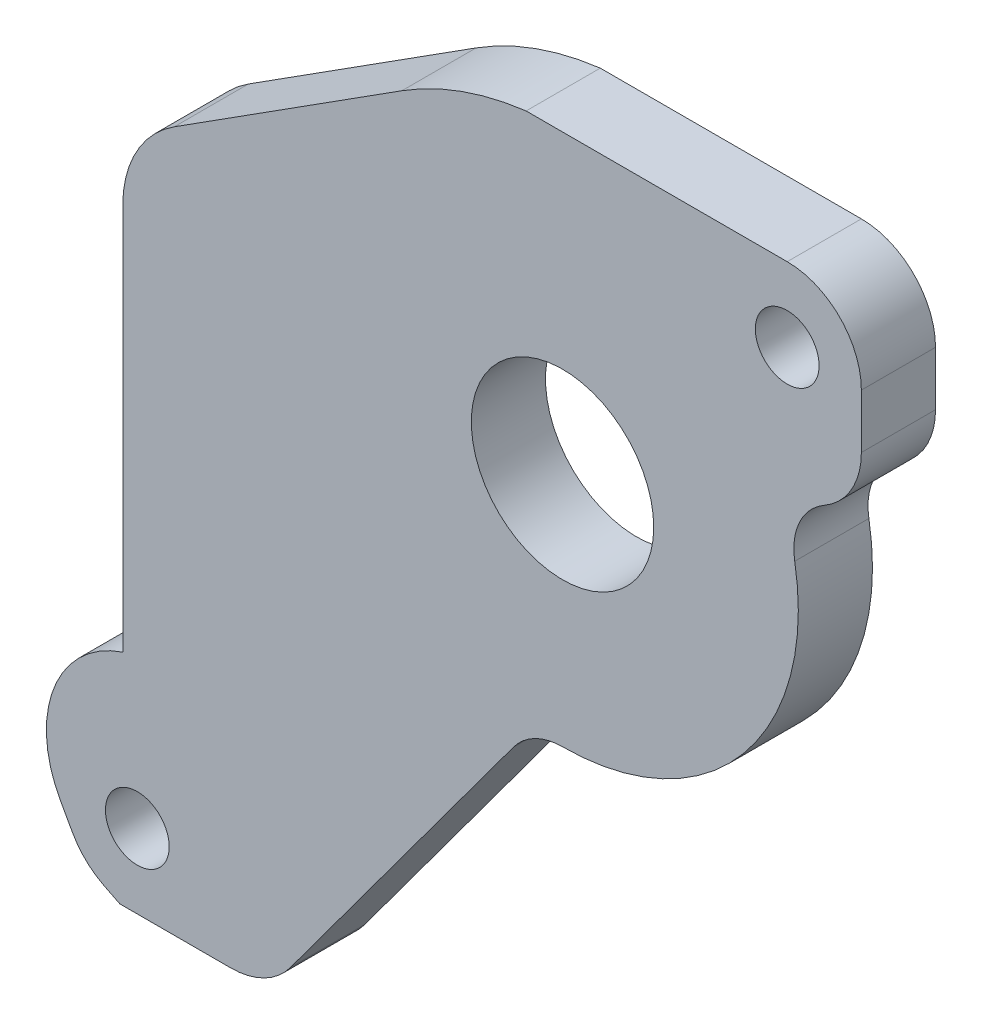
from build123d import *

# Parameters (mm, degrees)
SKETCH_1_W          = 80
SKETCH_1_H          = 60
SKETCH_1_R          = 6.15
EXTRUDE_1_DEPTH     = 5
SKETCH_2_R          = 2.15
CUT_EXTRUDE_1_DEPTH = 68.134361545
SKETCH_3_R          = 2.15
CUT_EXTRUDE_2_DEPTH = 68.134361545
CUT_EXTRUDE_3_DEPTH = 68.134361545
SKETCH_6_R          = 2.15
CUT_EXTRUDE_5_DEPTH = 68.134361545
CUT_EXTRUDE_7_DEPTH = 68.134361545
FILLET_1_R          = 7.5
CUT_EXTRUDE_8_DEPTH = 47.216858546
FILLET_2_R          = 5
FILLET_3_R          = 5


with BuildPart() as part:
    # ｽｹｯﾁ1 → ﾎﾞｽ - 押し出し1 (new body)
    with BuildSketch(Plane.XY):
        with Locations((-19.85, 0)):
            Rectangle(SKETCH_1_W, SKETCH_1_H)
        with Locations((0, 10)):
            Circle(SKETCH_1_R, mode=Mode.SUBTRACT)
    extrude(amount=EXTRUDE_1_DEPTH)

    # ｽｹｯﾁ2 → ｶｯﾄ - 押し出し1 (cut, through all)
    with BuildSketch(Plane.XY.offset(5)):
        with Locations((-54.85, 10)):
            Circle(SKETCH_2_R)
        with Locations(Location((-54.85, -10, 0), (0, 0, 180))):
            Circle(SKETCH_2_R)
        with Locations((-34.85, 10)):
            Circle(SKETCH_2_R)
        with Locations(Location((-34.85, -10, 0), (0, 0, 180))):
            Circle(SKETCH_2_R)
    extrude(amount=-CUT_EXTRUDE_1_DEPTH, mode=Mode.SUBTRACT)

    # ｽｹｯﾁ3 → ｶｯﾄ - 押し出し2 (cut, through all)
    with BuildSketch(Plane.XY.offset(5)):
        with Locations((15.15, 25)):
            Circle(SKETCH_3_R)
        with BuildLine():
            ThreePointArc((15.15, 30), (18.685533906, 28.535533906), (20.15, 25))
            Line((20.15, 25), (20.15, 30))
            Line((20.15, 30), (15.15, 30))
        make_face()
    extrude(amount=-CUT_EXTRUDE_2_DEPTH, mode=Mode.SUBTRACT)

    # ｽｹｯﾁ4 → ｶｯﾄ - 押し出し3 (cut, through all)
    with BuildSketch(Plane.XY.offset(5)):
        Polygon((-59.85, 30), (-59.85, 15), (-29.85, 30), align=None)
        Polygon((-29.85, -30), (-59.85, -15), (-59.85, -30), align=None)
        with BuildLine():
            Line((20.15, 0), (17.493498792, 0))
            ThreePointArc((17.493498792, 0), (15.094907291, -3.347893986), (12.06572435, -6.138178209))
            Line((12.06572435, -6.138178209), (-19.85, -30))
            Line((-19.85, -30), (20.15, -30))
            Line((20.15, -30), (20.15, 0))
        make_face()
        with BuildLine():
            ThreePointArc((20.15, 10), (19.474553919, 4.8265824), (17.493498792, 0))
            Line((17.493498792, 0), (20.15, 0))
            Line((20.15, 0), (20.15, 10))
        make_face()
    extrude(amount=-CUT_EXTRUDE_3_DEPTH, mode=Mode.SUBTRACT)

    # ｽｹｯﾁ6 → ｶｯﾄ - 押し出し5 (cut, through all)
    with BuildSketch(Plane.XY.offset(5)):
        with Locations((-28.669660113, -25)):
            Circle(SKETCH_6_R)
    extrude(amount=-CUT_EXTRUDE_5_DEPTH, mode=Mode.SUBTRACT)

    # ｽｹｯﾁ7 → ｶｯﾄ - 押し出し7 (cut, through all)
    with BuildSketch(Plane.XY.offset(5)):
        with BuildLine():
            Line((-33.038002917, -27.432607888), (-39.85, -15.2))
            Line((-39.85, -15.2), (-29.65, -15.2))
            Line((-29.65, -15.2), (-29.65, 15))
            Line((-29.65, 15), (-10.828193198, 26.993314334))
            ThreePointArc((-10.828193198, 26.993314334), (-6.809164655, 28.964645441), (-2.454078238, 30))
            Line((-2.454078238, 30), (-29.85, 30))
            Line((-29.85, 30), (-59.85, 15))
            Line((-59.85, 15), (-59.85, -15))
            Line((-59.85, -15), (-30.90572732, -29.47213634))
            ThreePointArc((-30.90572732, -29.47213634), (-32.125738379, -28.613242729), (-33.038002917, -27.432607888))
        make_face()
    extrude(amount=-CUT_EXTRUDE_7_DEPTH, mode=Mode.SUBTRACT)

    # ﾌｨﾚｯﾄ1
    # the kernel refuses this fillet: 7.5 mm, written as the material it takes off along each edge
    with BuildSketch(Plane(origin=(-39.85, -15.2, 35.821289963), x_dir=(1, 0, 0), z_dir=(0, 0, -1))) as fillet_1_piece_1:
        with BuildLine():
            CenterArc((12.550603255, 7.122124988), FILLET_1_R, 150.887789783, 100.847129313)
            Line((5.998089047, 10.77103682), (5.867038763, 10.844015057))
            Line((5.867038763, 10.844015057), (-0.131050284, 0.072978237))
            Line((-0.131050284, 0.072978237), (0, -0.15))
            ThreePointArc((0, -0.15), (5.1, -0.15), (10.152987935, -0.1424425))
            Line((10.152987935, -0.1424425), (10.2, 0))
        make_face()
    extrude(amount=66.642579926, mode=Mode.SUBTRACT)
    with BuildSketch(Plane(origin=(-29.65, 15, 15.285449565), x_dir=(0.8433406617465673, 0.5373793150511676, 0), z_dir=(0, 0, -1))) as fillet_1_piece_2:
        with BuildLine():
            CenterArc((FILLET_1_R * 0.548557310151, FILLET_1_R), FILLET_1_R, 212.505415036, 57.494584964)
            Line((-FILLET_1_R * 0.294783351595, FILLET_1_R * 0.462620684949), (-FILLET_1_R * 0.31165016483, FILLET_1_R * 0.451873098648))
            Line((-FILLET_1_R * 0.31165016483, FILLET_1_R * 0.451873098648), (-FILLET_1_R * 0.010971146203, -FILLET_1_R * 0.02))
            Line((-FILLET_1_R * 0.010971146203, -FILLET_1_R * 0.02), (FILLET_1_R * 0.548557310151, -FILLET_1_R * 0.02))
            Line((FILLET_1_R * 0.548557310151, -FILLET_1_R * 0.02), (FILLET_1_R * 0.548557310151, 0))
        make_face()
    extrude(amount=25.570899131, mode=Mode.SUBTRACT)

    # ｽｹｯﾁ8 → ｶｯﾄ - 押し出し8 (cut, through all)
    with BuildSketch(Plane.XY.offset(5)):
        with BuildLine():
            Line((-3.299299523, -7.565945223), (-19.85, -30))
            Line((-19.85, -30), (1.477219454, -14.054684007))
            ThreePointArc((1.477219454, -14.054684007), (0.73895718, -14.088668338), (0, -14.1))
            ThreePointArc((0, -14.1), (-3.659892388, -11.848022648), (-3.299299523, -7.565945223))
        make_face()
        with BuildLine():
            ThreePointArc((0, -5.9), (-1.848022648, -6.340107612), (-3.299299523, -7.565945223))
            ThreePointArc((-3.299299523, -7.565945223), (-3.659892388, -11.848022648), (0, -14.1))
            ThreePointArc((0, -14.1), (0.73895718, -14.088668338), (1.477219454, -14.054684007))
            Line((1.477219454, -14.054684007), (12.06572435, -6.138178209))
            ThreePointArc((12.06572435, -6.138178209), (18.015921371, 0.975085753), (20.15, 10))
            Line((20.15, 10), (20.15, 17.547767201))
            ThreePointArc((20.15, 17.547767201), (16.706289505, 16.278441046), (15.658443273, 12.761006025))
            ThreePointArc((15.658443273, 12.761006025), (12.180106646, -0.220322994), (0, -5.9))
        make_face()
    extrude(amount=-CUT_EXTRUDE_8_DEPTH, mode=Mode.SUBTRACT)

    # ﾌｨﾚｯﾄ2
    fillet_2_edges = [part.edges().sort_by_distance(p)[0] for p in [
        (-19.85, -30, 2.5),
    ]]
    fillet(fillet_2_edges, radius=FILLET_2_R)

    # ﾌｨﾚｯﾄ3
    fillet_3_edges = [part.edges().sort_by_distance(p)[0] for p in [
        (20.15, 17.547767201, 2.5),
    ]]
    fillet(fillet_3_edges, radius=FILLET_3_R)


solid = part.part
